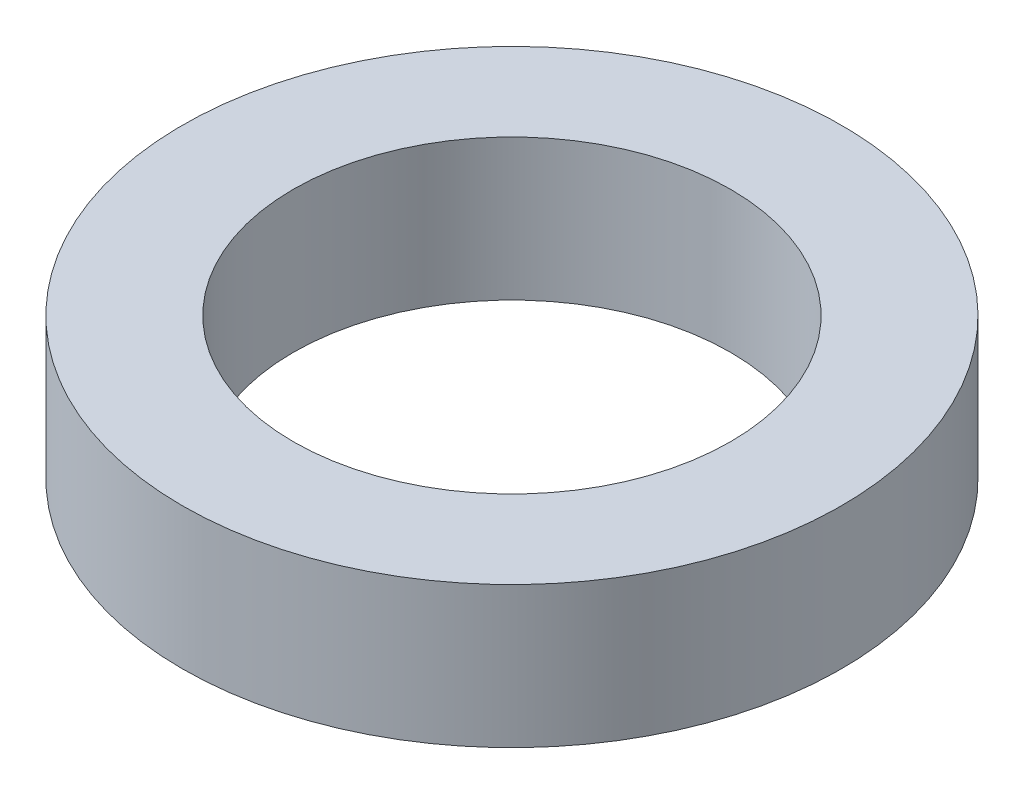
from build123d import *

# Parameters (mm, degrees)
SKETCH1_R           = 7.27458794
SKETCH1_R_2         = 4.826
BOSS_EXTRUDE1_DEPTH = 3.11785


with BuildPart() as part:
    # Sketch1 → Boss-Extrude1 (new body)
    with BuildSketch(Plane(origin=(0, 0, 0), x_dir=(1, 0, 0), z_dir=(0, 1, 0))):
        Circle(SKETCH1_R)
        Circle(SKETCH1_R_2, mode=Mode.SUBTRACT)
    extrude(amount=BOSS_EXTRUDE1_DEPTH)


solid = part.part
